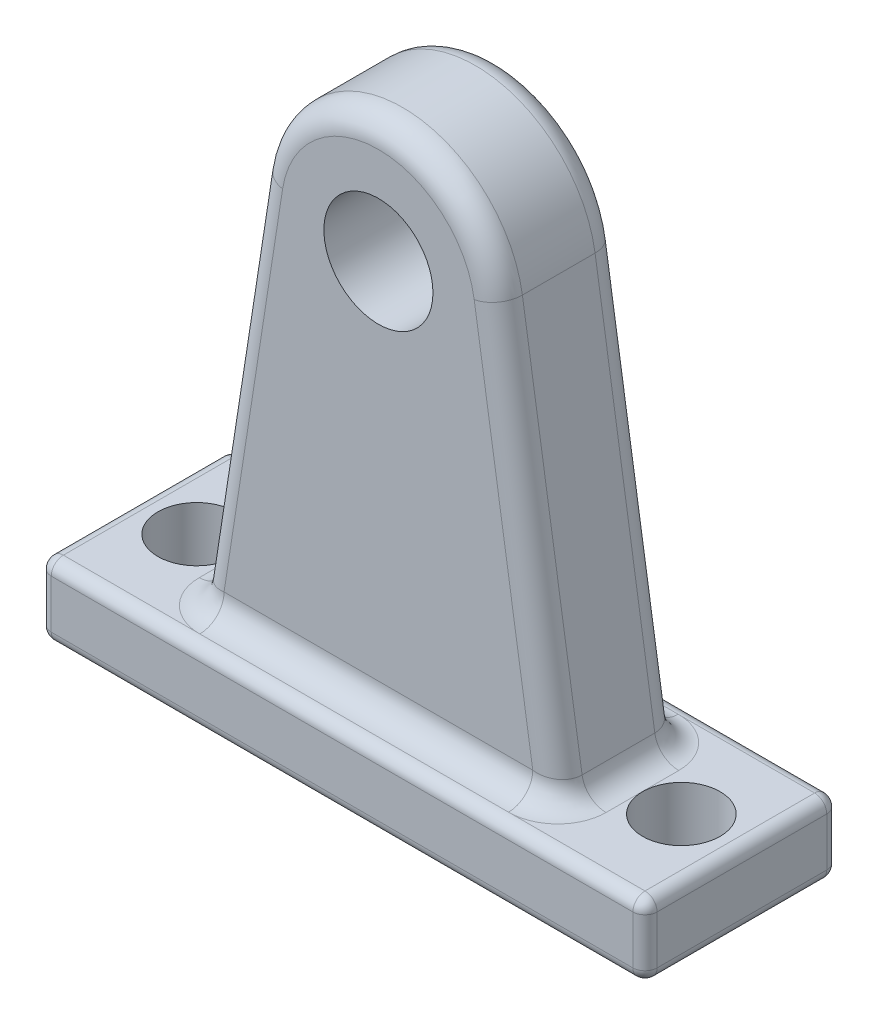
from build123d import *

# Parameters (mm, degrees)
SKETCH_2_R          = 2.25
EXTRUDE_1_DEPTH     = 2.5
SKETCH_4_W          = 25
SKETCH_4_H          = 8
EXTRUDE_2_DEPTH     = 3
SKETCH_5_R          = 1.6
CUT_EXTRUDE_1_DEPTH = 3
FILLET_1_R          = 1
FILLET_2_R          = 0.5


with BuildPart() as part:
    # 草图2 → 凸台-拉伸1 (new, symmetric)
    with BuildSketch(Plane.XY):
        with BuildLine():
            Line((-8, 0), (8, 0))
            Line((8, 0), (4.941176471, 19.764705882))
            ThreePointArc((4.941176471, 19.764705882), (0, 24), (-4.941176471, 19.764705882))
            Line((-4.941176471, 19.764705882), (-8, 0))
        make_face()
        with Locations((0, 19)):
            Circle(SKETCH_2_R, mode=Mode.SUBTRACT)
    extrude(amount=EXTRUDE_1_DEPTH, both=True)

    # 草图4 → 凸台-拉伸2 (add)
    with BuildSketch(Plane.XZ):
        Rectangle(SKETCH_4_W, SKETCH_4_H)
    extrude(amount=-EXTRUDE_2_DEPTH)

    # 草图5 → 切除-拉伸1 (cut)
    with BuildSketch(Plane(origin=(0, 3, 0), x_dir=(1, 0, 0), z_dir=(0, 1, 0))):
        with Locations(Location((-10, 0, 0), (0, 0, 270))):
            Circle(SKETCH_5_R)
    cut_extrude_1 = extrude(amount=-CUT_EXTRUDE_1_DEPTH, mode=Mode.SUBTRACT)

    # 镜向1: 切除-拉伸1 across plane
    add(cut_extrude_1.mirror(Plane(origin=(0, 0, 0), x_dir=(0, 0, 1), z_dir=(1, 0, 0))), mode=Mode.SUBTRACT)

    # 圆角1
    fillet_1_edges = [part.edges().sort_by_distance(p)[0] for p in [
        (-6.238445378, 11.382352941, 2.5),
        (-7.535714286, 3, 0),
        (6.238445378, 11.382352941, -2.5),
        (6.238445378, 11.382352941, 2.5),
        (0, 3, 2.5),
        (7.535714286, 3, 0),
        (0, 3, -2.5),
        (-6.238445378, 11.382352941, -2.5),
        (0, 24, -2.5),
        (0, 24, 2.5),
    ]]
    fillet(fillet_1_edges, radius=FILLET_1_R)

    # 圆角2
    fillet_2_edges = [part.edges().sort_by_distance(p)[0] for p in [
        (12.5, 0, 0),
        (0, 0, 4),
        (-12.5, 0, 0),
        (0, 0, -4),
        (12.5, 3, 0),
        (12.5, 1.5, 4),
        (0, 3, -4),
        (12.5, 1.5, -4),
        (-12.5, 3, 0),
        (-12.5, 1.5, -4),
        (0, 3, 4),
        (-12.5, 1.5, 4),
    ]]
    fillet(fillet_2_edges, radius=FILLET_2_R - 0.0001)  # a hair under: the kernel refuses the full size


solid = part.part
